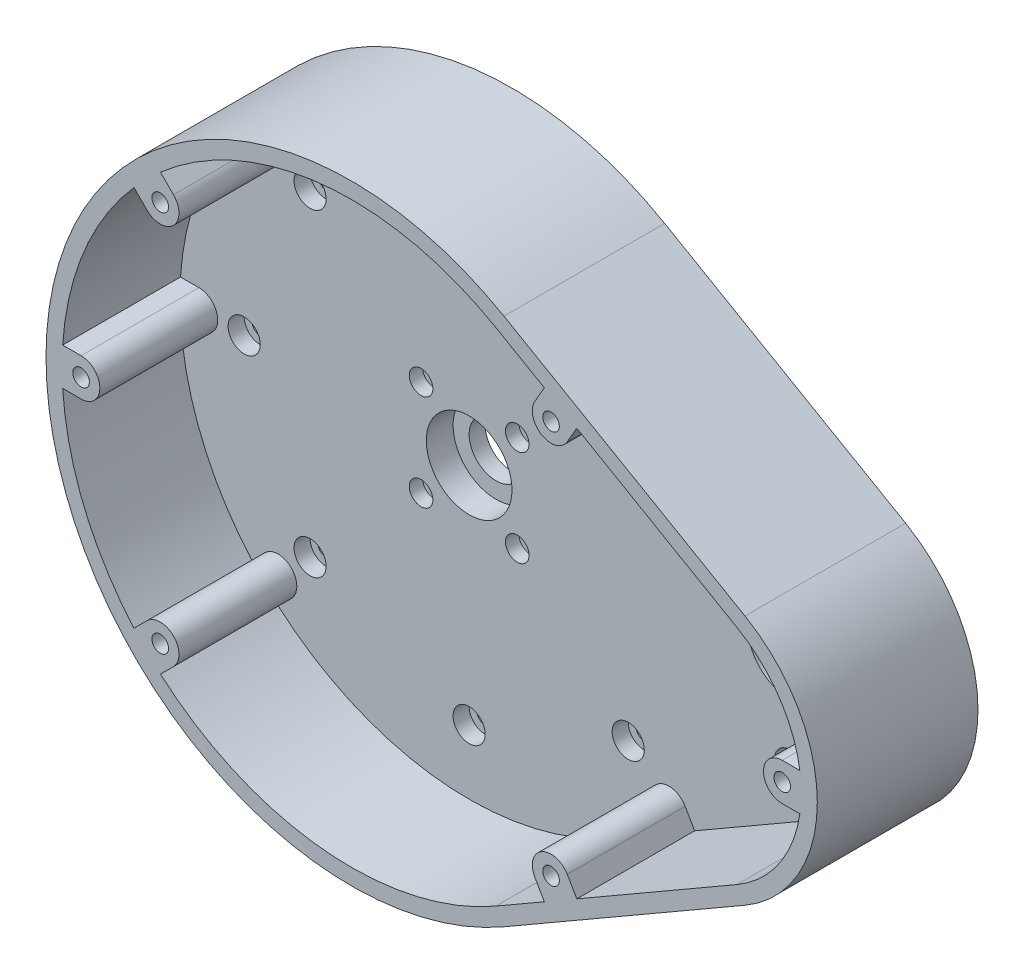
from build123d import *
from build123d.topology import SkipClean

# Parameters (mm, degrees)
BOSS_EXTRUDE1_DEPTH = 30
SKETCH3_R           = 1.55
CUT_EXTRUDE1_DEPTH  = 22
CUT_EXTRUDE2_START  = -30
SKETCH5_R           = 1.55
CUT_EXTRUDE2_DEPTH  = 30
SKETCH6_R           = 3
CUT_EXTRUDE3_DEPTH  = 5
SKETCH7_R           = 8
CUT_EXTRUDE10_DEPTH = 5
SKETCH8_R           = 5
SKETCH8_R_2         = 1.05
CUT_EXTRUDE7_DEPTH  = 8
SKETCH9_R           = 2.2
CUT_EXTRUDE8_DEPTH  = 2.5
SKETCH11_R          = 1.55
CUT_EXTRUDE11_DEPTH = 8
SKETCH12_R          = 3
CUT_EXTRUDE12_DEPTH = 3


with BuildPart() as part:
    # Sketch1 → Boss-Extrude1 (new body)
    with BuildSketch(Plane.XY):
        with BuildLine():
            Line((-1.5, 49.363448016), (43.5, 23.382685902))
            ThreePointArc((43.5, 23.382685902), (57, 0), (43.5, -23.382685902))
            Line((43.5, -23.382685902), (-1.5, -49.363448016))
            ThreePointArc((-1.5, -49.363448016), (-87, 0), (-1.5, 49.363448016))
        make_face()
    extrude(amount=BOSS_EXTRUDE1_DEPTH)

    # Sketch3 → Cut-Extrude1 (cut)
    with BuildSketch(Plane.XY.offset(30)):
        with Locations((50.449984706, 0.025940866)):
            Circle(SKETCH3_R)
        with Locations((-80.45, 0)):
            Circle(SKETCH3_R)
        with Locations((-65.673537111, 35.673537111)):
            Circle(SKETCH3_R)
        with Locations((7.291641994, -36.724302618)):
            Circle(SKETCH3_R)
        with Locations((-65.673537111, -35.673537111)):
            Circle(SKETCH3_R)
        with Locations((7.291641994, 36.724302618)):
            Circle(SKETCH3_R)
        with BuildLine():
            Line((50.449984706, 3.525940866), (53.739581736, 3.525940866))
            ThreePointArc((53.739581736, 3.525940866), (49.844264614, 13.498339229), (42, 20.784609691))
            Line((42, 20.784609691), (12.097730907, 38.048692801))
            Line((12.097730907, 38.048692801), (10.322730907, 34.974302618))
            ThreePointArc((10.322730907, 34.974302618), (5.541641994, 33.693213704), (4.26055308, 38.474302618))
            Line((4.26055308, 38.474302618), (6.03555308, 41.548692801))
            Line((6.03555308, 41.548692801), (-3, 46.765371804))
            ThreePointArc((-3, 46.765371804), (-35.308766962, 53.738412643), (-65.628603797, 40.578351266))
            Line((-65.628603797, 40.578351266), (-63.198663377, 38.148410845))
            ThreePointArc((-63.198663377, 38.148410845), (-63.198663377, 33.198663377), (-68.148410845, 33.198663377))
            Line((-68.148410845, 33.198663377), (-70.578351266, 35.628603797))
            ThreePointArc((-70.578351266, 35.628603797), (-79.889494756, 20.664905348), (-83.886454699, 3.5))
            Line((-83.886454699, 3.5), (-80.45, 3.5))
            ThreePointArc((-80.45, 3.5), (-76.95, 0), (-80.45, -3.5))
            Line((-80.45, -3.5), (-83.886454699, -3.5))
            ThreePointArc((-83.886454699, -3.5), (-79.889494756, -20.664905348), (-70.578351266, -35.628603797))
            Line((-70.578351266, -35.628603797), (-68.148410845, -33.198663377))
            ThreePointArc((-68.148410845, -33.198663377), (-63.198663377, -33.198663377), (-63.198663377, -38.148410845))
            Line((-63.198663377, -38.148410845), (-65.628603797, -40.578351266))
            ThreePointArc((-65.628603797, -40.578351266), (-35.308766962, -53.738412643), (-3, -46.765371804))
            Line((-3, -46.765371804), (6.035553081, -41.548692801))
            Line((6.035553081, -41.548692801), (4.260553081, -38.474302618))
            ThreePointArc((4.260553081, -38.474302618), (5.541641994, -33.693213705), (10.322730907, -34.974302618))
            Line((10.322730907, -34.974302618), (12.097730907, -38.048692801))
            Line((12.097730907, -38.048692801), (42, -20.784609691))
            ThreePointArc((42, -20.784609691), (49.859000377, -13.476650327), (53.747229589, -3.474059134))
            Line((53.747229589, -3.474059134), (50.449984706, -3.474059134))
            ThreePointArc((50.449984706, -3.474059134), (46.949984706, 0.025940866), (50.449984706, 3.525940866))
        make_face()
    extrude(amount=-CUT_EXTRUDE1_DEPTH, mode=Mode.SUBTRACT)

    # Sketch5 → Cut-Extrude2 (cut)
    with SkipClean():  # the faces are left unmerged after this step: merging them gives an invalid solid
        with BuildSketch(Plane(origin=(0, 0, 0), x_dir=(-1, 0, 0), z_dir=(0, 0, -1)).offset(CUT_EXTRUDE2_START)):
            with Locations((65.673537111, 35.673537111)):
                Circle(SKETCH5_R)
            with Locations((80.45, 0)):
                Circle(SKETCH5_R)
            with Locations((-50.449984706, 0.025940866)):
                Circle(SKETCH5_R)
            with Locations((-7.291641994, -36.724302618)):
                Circle(SKETCH5_R)
            with Locations((65.673537111, -35.673537111)):
                Circle(SKETCH5_R)
            with Locations((-7.291641994, 36.724302618)):
                Circle(SKETCH5_R)
        extrude(amount=CUT_EXTRUDE2_DEPTH, mode=Mode.SUBTRACT)

    # Sketch6 → Cut-Extrude3 (cut)
    with SkipClean():  # the faces are left unmerged after this step: merging them gives an invalid solid
        with BuildSketch(Plane(origin=(0, 0, 0), x_dir=(-1, 0, 0), z_dir=(0, 0, -1))):
            with Locations((-50.449984706, 0.025940866)):
                Circle(SKETCH6_R)
            with Locations((-7.291641994, -36.724302618)):
                Circle(SKETCH6_R)
            with Locations((80.45, 0)):
                Circle(SKETCH6_R)
            with Locations((65.673537111, 35.673537111)):
                Circle(SKETCH6_R)
            with Locations((65.673537111, -35.673537111)):
                Circle(SKETCH6_R)
            with Locations((-7.291641994, 36.724302618)):
                Circle(SKETCH6_R)
        extrude(amount=-CUT_EXTRUDE3_DEPTH, mode=Mode.SUBTRACT)

    # Sketch7 → Cut-Extrude10 (cut)
    with SkipClean():  # the faces are left unmerged after this step: merging them gives an invalid solid
        with BuildSketch(Plane.XY.offset(8)):
            with Locations((-30, 0)):
                Circle(SKETCH7_R)
            with Locations((30, 0)):
                Circle(SKETCH7_R)
        extrude(amount=-CUT_EXTRUDE10_DEPTH, mode=Mode.SUBTRACT)

    # Sketch8 → Cut-Extrude7 (cut)
    with SkipClean():  # the faces are left unmerged after this step: merging them gives an invalid solid
        with BuildSketch(Plane.XY.offset(8)):
            with Locations((-30, 0)):
                Circle(SKETCH8_R)
            with Locations((-38.980256121, 8.980256121)):
                Circle(SKETCH8_R_2)
            with Locations((-21.019743879, 8.980256121)):
                Circle(SKETCH8_R_2)
            with Locations((-21.019743879, -8.980256121)):
                Circle(SKETCH8_R_2)
            with Locations((-38.980256121, -8.980256121)):
                Circle(SKETCH8_R_2)
        extrude(amount=-CUT_EXTRUDE7_DEPTH, mode=Mode.SUBTRACT)

    # Sketch9 → Cut-Extrude8 (cut)
    with SkipClean():  # the faces are left unmerged after this step: merging them gives an invalid solid
        with BuildSketch(Plane.XY.offset(8)):
            with Locations((-38.980256121, 8.980256121)):
                Circle(SKETCH9_R)
            with Locations((-21.019743879, 8.980256121)):
                Circle(SKETCH9_R)
            with Locations((-21.019743879, -8.980256121)):
                Circle(SKETCH9_R)
            with Locations((-38.980256121, -8.980256121)):
                Circle(SKETCH9_R)
        extrude(amount=-CUT_EXTRUDE8_DEPTH, mode=Mode.SUBTRACT)

    # Sketch11 → Cut-Extrude11 (cut)
    with SkipClean():  # the faces are left unmerged after this step: merging them gives an invalid solid
        with BuildSketch(Plane.XY.offset(8)):
            with Locations((-0.30151519, 29.69848481)):
                Circle(SKETCH11_R)
            with Locations((-30, 42)):
                Circle(SKETCH11_R)
            with Locations((-59.69848481, 29.69848481)):
                Circle(SKETCH11_R)
            with Locations((-72, 0)):
                Circle(SKETCH11_R)
            with Locations((-59.69848481, -29.69848481)):
                Circle(SKETCH11_R)
            with Locations((-30, -42)):
                Circle(SKETCH11_R)
            with Locations((-0.30151519, -29.69848481)):
                Circle(SKETCH11_R)
            with Locations((30, 19)):
                Circle(SKETCH11_R)
            with Locations((30, -19)):
                Circle(SKETCH11_R)
            with Locations((42, 0)):
                Circle(SKETCH11_R)
        extrude(amount=-CUT_EXTRUDE11_DEPTH, mode=Mode.SUBTRACT)

    # Sketch12 → Cut-Extrude12 (cut)
    with SkipClean():  # the faces are left unmerged after this step: merging them gives an invalid solid
        with BuildSketch(Plane.XY.offset(8)):
            with Locations((-0.30151519, 29.69848481)):
                Circle(SKETCH12_R)
            with Locations((-30, 42)):
                Circle(SKETCH12_R)
            with Locations((-59.69848481, 29.69848481)):
                Circle(SKETCH12_R)
            with Locations((-72, 0)):
                Circle(SKETCH12_R)
            with Locations((-59.69848481, -29.69848481)):
                Circle(SKETCH12_R)
            with Locations((-30, -42)):
                Circle(SKETCH12_R)
            with Locations((-0.30151519, -29.69848481)):
                Circle(SKETCH12_R)
            with Locations((30, 19)):
                Circle(SKETCH12_R)
            with Locations((42, 0)):
                Circle(SKETCH12_R)
            with Locations((30, -19)):
                Circle(SKETCH12_R)
        extrude(amount=-CUT_EXTRUDE12_DEPTH, mode=Mode.SUBTRACT)


solid = part.part
